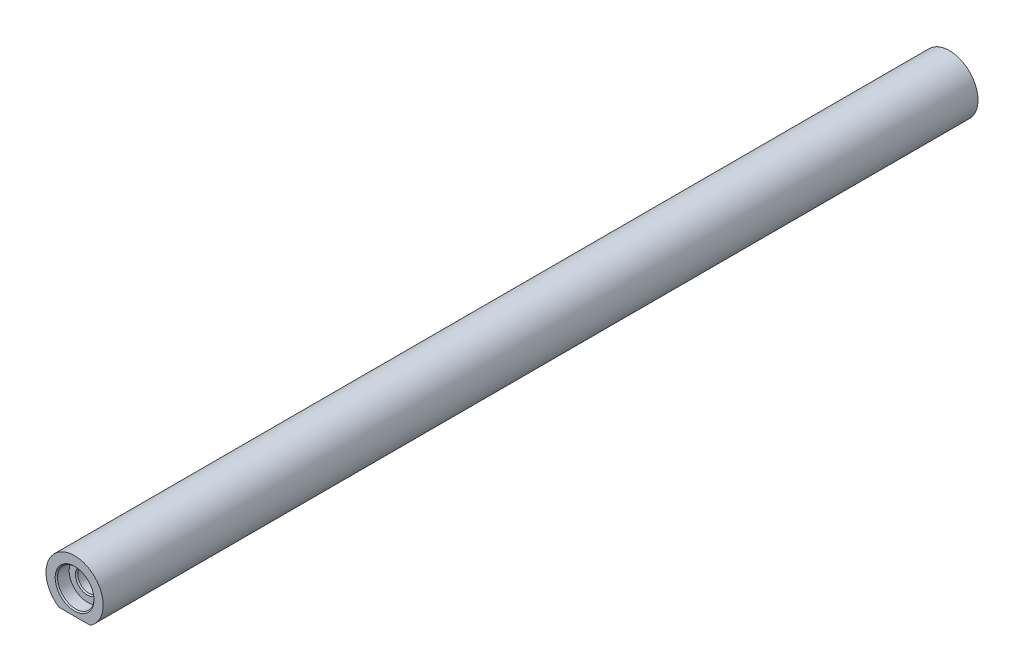
from build123d import *

# Parameters (mm, degrees)
SKETCH1_R           = 4.9
BOSS_EXTRUDE1_DEPTH = 75
SKETCH5_R           = 3.125
CUT_EXTRUDE1_DEPTH  = 2.2
CHAMFER1_SIZE       = 0.2
CUT_EXTRUDE2_DEPTH  = 151.159981353


with BuildPart() as part:
    # Sketch1 → Boss-Extrude1 (new, symmetric)
    with BuildSketch(Plane.XY):
        Circle(SKETCH1_R)
    extrude(amount=BOSS_EXTRUDE1_DEPTH, both=True)

    # Sketch4 → Hole1 (revolve, cut)
    with BuildSketch(Plane(origin=(0, 0, 75), x_dir=(0, -1, 0), z_dir=(1, 0, 0))):
        Polygon((0, 0), (0, 13.85), (1.85, 12), (1.85, 0), align=None)
    hole1 = revolve(axis=Axis((0, 0, 79.244199587), (0, 0, -1)), mode=Mode.SUBTRACT)

    # Sketch5 → Cut-Extrude1 (cut)
    with BuildSketch(Plane.XY.offset(75)):
        Circle(SKETCH5_R)
    cut_extrude1 = extrude(amount=-CUT_EXTRUDE1_DEPTH, mode=Mode.SUBTRACT)

    # Mirror2: Hole1, Cut-Extrude1 across plane
    add(hole1.mirror(Plane.XY), mode=Mode.SUBTRACT)
    add(cut_extrude1.mirror(Plane.XY), mode=Mode.SUBTRACT)

    # Chamfer1
    chamfer1_edges = [part.edges().sort_by_distance(p)[0] for p in [
        (0, 1.85, 72.8),
        (-3.125, 0, 75),
        (-3.125, 0, -75),
        (0, 1.85, -72.8),
    ]]
    chamfer(chamfer1_edges, length=CHAMFER1_SIZE)

    # Sketch6 → Cut-Extrude2 (cut, through all)
    with BuildSketch(Plane.XY.offset(75)):
        with BuildLine():
            Line((2.683281573, -4.1), (-2.683281573, -4.1))
            ThreePointArc((-2.683281573, -4.1), (0, -4.9), (2.683281573, -4.1))
        make_face()
    extrude(amount=-CUT_EXTRUDE2_DEPTH, mode=Mode.SUBTRACT)


solid = part.part
